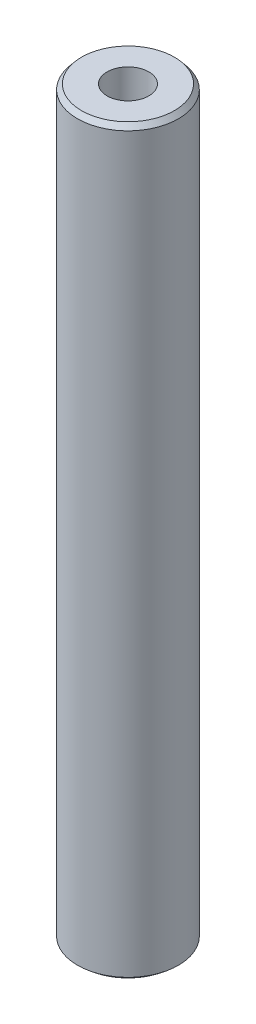
from build123d import *
from OCP.BRepFilletAPI import BRepFilletAPI_MakeChamfer

# Parameters (mm, degrees)
SKETCH1_R           = 32.5
BOSS_EXTRUDE1_DEPTH = 477.664512005
SKETCH2_R           = 13.43254164
CUT_EXTRUDE1_DEPTH  = 480.870697198
CHAMFER1_SIZE       = 3.203734333
CHAMFER1_SIZE2      = 2.632013032


with BuildPart() as part:
    # Sketch1 → Boss-Extrude1 (new body)
    with BuildSketch(Plane(origin=(0, 0, 0), x_dir=(1, 0, 0), z_dir=(0, 1, 0))):
        Circle(SKETCH1_R)
    extrude(amount=BOSS_EXTRUDE1_DEPTH)

    # Sketch2 → Cut-Extrude1 (cut, through all)
    with BuildSketch(Plane(origin=(0, 0, 0), x_dir=(1, 0, 0), z_dir=(0, 1, 0))):
        Circle(SKETCH2_R)
    extrude(amount=CUT_EXTRUDE1_DEPTH, mode=Mode.SUBTRACT)

    # Chamfer1: one chamfer whose edges measure the first distance from different faces: ONE call of the kernel's chamfer builder (chamfer() names one face for all edges)
    chamfer1_edges_1 = [part.edges().sort_by_distance(p)[0] for p in [
        (-32.5, 477.664512005, 0),
    ]]
    chamfer1_side_1 = [part.faces().sort_by_distance(p)[0] for p in [
        (-32.5, 238.832256002, 0),
    ]]
    chamfer1_edges_2 = [part.edges().sort_by_distance(p)[0] for p in [
        (-32.5, 0, 0),
    ]]
    chamfer1_side_2 = [part.faces().sort_by_distance(p)[0] for p in [
        (-31.580761184, 0, 0),
    ]]
    chamfer1 = BRepFilletAPI_MakeChamfer(part.part.solid().wrapped)
    for e in chamfer1_edges_1:
        chamfer1.Add(CHAMFER1_SIZE, CHAMFER1_SIZE2, e.wrapped, chamfer1_side_1[0].wrapped)  # the first distance lies on this face
    for e in chamfer1_edges_2:
        chamfer1.Add(CHAMFER1_SIZE, CHAMFER1_SIZE2, e.wrapped, chamfer1_side_2[0].wrapped)  # the first distance lies on this face
    add(Compound.cast(chamfer1.Shape()), mode=Mode.REPLACE)


solid = part.part
